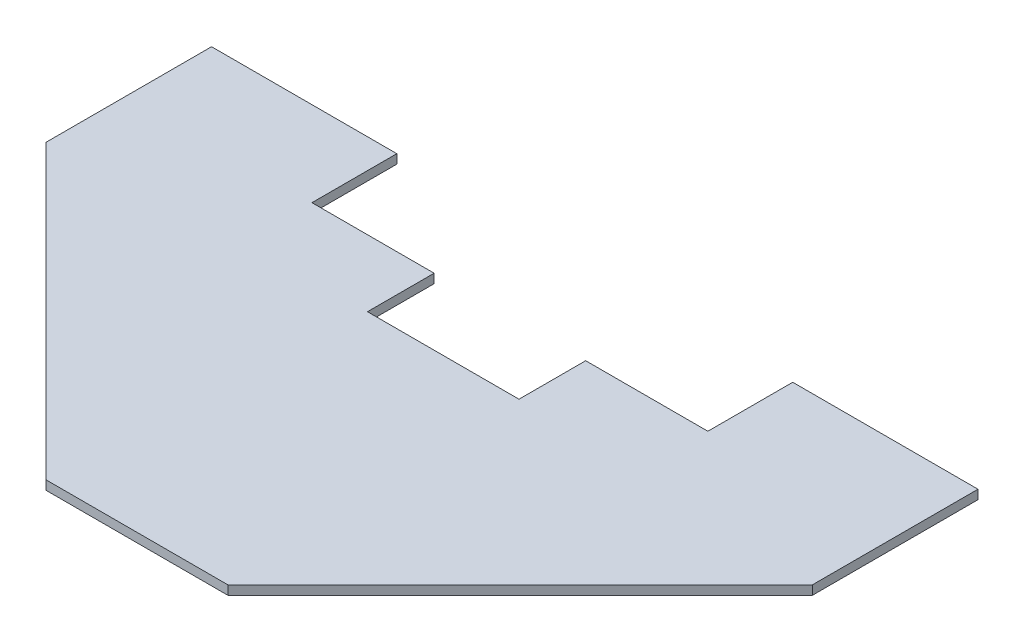
from build123d import *

# Parameters (mm, degrees)
SM_BASE_FLANGE_1_DEPTH = 6


# Sheet-metal steps are written as plain solids
with BuildPart() as part:
    # Sketch 1 → Базовая кромка1 (new body)
    with BuildSketch(Plane(origin=(0, 0, 0), x_dir=(1, 0, 0), z_dir=(0, 1, 0))):
        Polygon((0, -202.132034356), (60, -202.132034356), (252.882034356, -9.25), (252.882034356, 100), (130.626438318, 100), (130.626438318, 44), (50, 44), (50, 0), (0, 0), align=None)
    extrude(amount=-SM_BASE_FLANGE_1_DEPTH)

    # Зеркальное отражение1: part across plane


with BuildPart() as part_1:
    add(part.part)
    add(part.part.mirror(Plane(origin=(0, -6, 0), x_dir=(0, 0, 1), z_dir=(-1, 0, 0))))


solid = part_1.part
